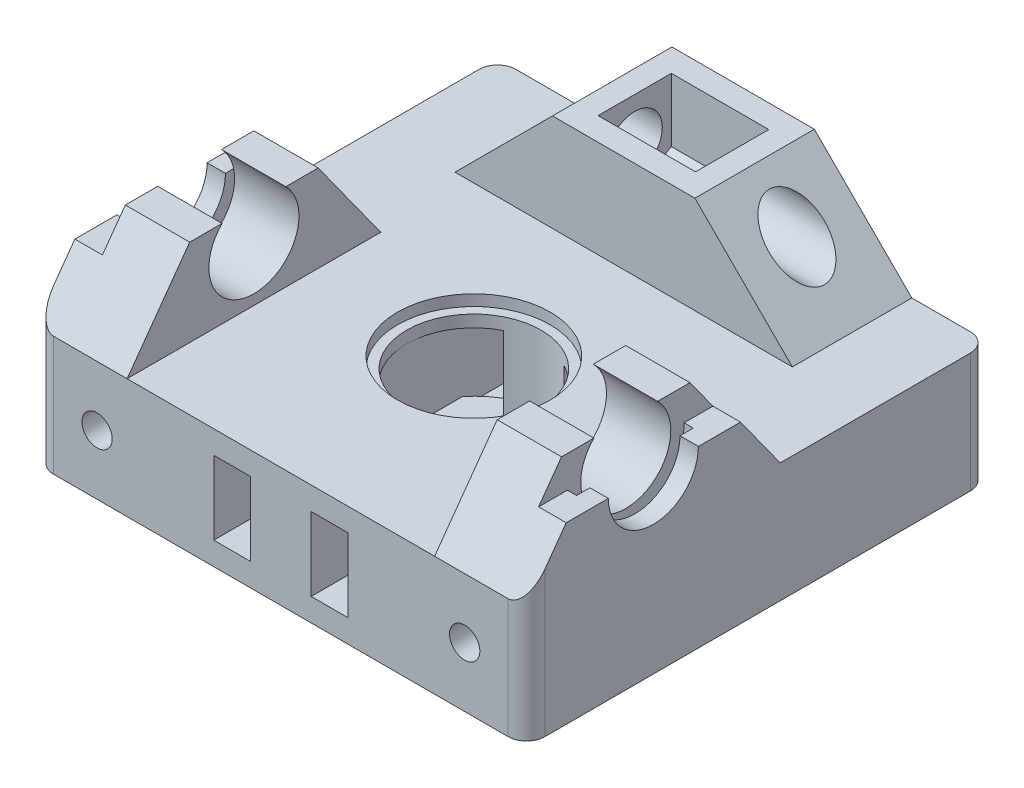
from build123d import *

# Parameters (mm, degrees)
SKETCH1_W           = 53.4573
SKETCH1_H           = 13
SKETCH1_R           = 4.2
BOSS_EXTRUDE1_DEPTH = 50.3
BOSS_EXTRUDE2_START = -15
SKETCH3_R           = 4.2
BOSS_EXTRUDE2_DEPTH = 15
SKETCH8_W           = 15.5
SKETCH8_H           = 13
BOSS_EXTRUDE3_DEPTH = 10.6
CHAMFER1_SIZE       = 10.6
SKETCH5_R           = 3
SKETCH5_R_2         = 4
CUT_EXTRUDE1_DEPTH  = 76.366988286
CUT_EXTRUDE2_DEPTH  = 5.3
BOSS_EXTRUDE4_DEPTH = 10
CUT_EXTRUDE3_DEPTH  = 1
SKETCH13_W          = 21.695080859
SKETCH13_H          = 9.09610943
CUT_EXTRUDE4_DEPTH  = 3
SKETCH16_R          = 1.65
CUT_EXTRUDE5_DEPTH  = 59.425257644
SKETCH17_R          = 7.3
CUT_EXTRUDE6_DEPTH  = 10.5
SKETCH15_W          = 4
SKETCH15_H          = 8
CUT_EXTRUDE7_DEPTH  = 60.472016368
SKETCH18_R          = 8.3
CUT_EXTRUDE8_DEPTH  = 1.2
SKETCH21_R          = 1.65
CUT_EXTRUDE9_DEPTH  = 60.472016368
CUT_EXTRUDE10_DEPTH = 2.6
FILLET1_R           = 2
CUT_EXTRUDE11_START = -1
CUT_EXTRUDE11_DEPTH = 10


# Read off the part's stored shape, not the designer's step: Cut-Extrude11
with BuildPart() as part:
    # Sketch1 → Boss-Extrude1 (new body)
    with BuildSketch(Plane.XY):
        Rectangle(SKETCH1_W, SKETCH1_H)
        with Locations(Location((-20, 0, 0), (0, 0, 180))):
            Circle(SKETCH1_R, mode=Mode.SUBTRACT)
        with Locations(Location((20, 0, 0), (0, 0, 180))):
            Circle(SKETCH1_R, mode=Mode.SUBTRACT)
    extrude(amount=BOSS_EXTRUDE1_DEPTH)

    # Sketch3 → Boss-Extrude2 (add)
    with BuildSketch(Plane.XY.offset(50.3).offset(BOSS_EXTRUDE2_START)):
        with Locations(Location((-20, 0, 0), (0, 0, 180))):
            Circle(SKETCH3_R)
        with Locations(Location((20, 0, 0), (0, 0, 180))):
            Circle(SKETCH3_R)
    extrude(amount=BOSS_EXTRUDE2_DEPTH)

    # Sketch8 → Boss-Extrude3 (add)
    with BuildSketch(Plane(origin=(0, 6.5, 0), x_dir=(1, 0, 0), z_dir=(0, 1, 0))):
        with Locations((0, -6.5)):
            Rectangle(SKETCH8_W, SKETCH8_H)
    extrude(amount=BOSS_EXTRUDE3_DEPTH)

    # Chamfer1
    chamfer1_edges = [part.edges().sort_by_distance(p)[0] for p in [
        (7.75, 6.5, 6.5),
        (-7.75, 6.5, 6.5),
    ]]
    chamfer(chamfer1_edges, length=CHAMFER1_SIZE - 0.0001)  # a hair under: the kernel refuses the full size

    # Sketch5 → Cut-Extrude1 (cut, through all)
    with BuildSketch(Plane.ZY.offset(26.72865)):
        with Locations(Location((6.5, 12.5, 0), (0, 0, 270))):
            Circle(SKETCH5_R)
        with Locations((36.5, 12.5)):
            Circle(SKETCH5_R_2)
    extrude(amount=-CUT_EXTRUDE1_DEPTH, mode=Mode.SUBTRACT)

    # Sketch10 → Cut-Extrude2 (cut)
    with BuildSketch(Plane.ZY):
        Polygon((2.516283143, 14.8), (2.516283143, 17.1), (10.483716857, 17.1), (10.483716857, 14.8), (10.483716857, 10.2), (6.5, 7.9), (2.516283143, 10.2), align=None)
    cut_extrude2 = extrude(amount=-CUT_EXTRUDE2_DEPTH, mode=Mode.SUBTRACT)

    # Mirror1: Cut-Extrude2 across plane
    add(cut_extrude2.mirror(Plane.ZY), mode=Mode.SUBTRACT)

    # Sketch11 → Boss-Extrude4 (add)
    with BuildSketch(Plane.ZY.offset(26.72865)):
        with BuildLine():
            Line((33.035176772, 15.964823228), (29.509293572, 15.964823228))
            Line((29.509293572, 15.964823228), (22.7, 6.5))
            Line((22.7, 6.5), (50.3, 6.5))
            Line((50.3, 6.5), (43.490706428, 15.964823228))
            Line((43.490706428, 15.964823228), (39.964823228, 15.964823228))
            ThreePointArc((39.964823228, 15.964823228), (36.5, 7.6), (33.035176772, 15.964823228))
        make_face()
    boss_extrude4 = extrude(amount=-BOSS_EXTRUDE4_DEPTH)

    # Sketch12 → Cut-Extrude3 (cut)
    with BuildSketch(Plane.ZY.offset(24.72865)):
        with BuildLine():
            Line((30.15, 12.5), (30.15, 21.960655534))
            Line((30.15, 21.960655534), (42.85, 21.960655534))
            Line((42.85, 21.960655534), (42.85, 12.5))
            ThreePointArc((42.85, 12.5), (36.5, 6.15), (30.15, 12.5))
        make_face()
    cut_extrude3 = extrude(amount=-CUT_EXTRUDE3_DEPTH, mode=Mode.SUBTRACT)

    # Sketch13 → Cut-Extrude4 (cut)
    with BuildSketch(Plane.ZY.offset(26.72865)):
        with Locations((35.453328021, 17.048054715)):
            Rectangle(SKETCH13_W, SKETCH13_H)
    cut_extrude4 = extrude(amount=-CUT_EXTRUDE4_DEPTH, mode=Mode.SUBTRACT)

    # Mirror2: Boss-Extrude4, Cut-Extrude3, Cut-Extrude4 across plane
    add(boss_extrude4.mirror(Plane.ZY))
    add(cut_extrude3.mirror(Plane.ZY), mode=Mode.SUBTRACT)
    add(cut_extrude4.mirror(Plane.ZY), mode=Mode.SUBTRACT)

    # Sketch16 → Cut-Extrude5 (cut, through all)
    with BuildSketch(Plane(origin=(0, 6.5, 0), x_dir=(1, 0, 0), z_dir=(0, 1, 0))):
        with Locations(Location((0, -29.3, 0), (0, 0, 180))):
            Circle(SKETCH16_R)
    extrude(amount=-CUT_EXTRUDE5_DEPTH, mode=Mode.SUBTRACT)

    # Sketch17 → Cut-Extrude6 (cut)
    with BuildSketch(Plane(origin=(0, 6.5, 0), x_dir=(1, 0, 0), z_dir=(0, 1, 0))):
        with Locations(Location((0, -29.3, 0), (0, 0, 180))):
            Circle(SKETCH17_R)
    extrude(amount=-CUT_EXTRUDE6_DEPTH, mode=Mode.SUBTRACT)

    # Sketch15 → Cut-Extrude7 (cut, through all)
    with BuildSketch(Plane(origin=(0, 0, 0), x_dir=(-1, 0, 0), z_dir=(0, 0, -1))):
        with Locations((-5.3, 0)):
            Rectangle(SKETCH15_W, SKETCH15_H)
    cut_extrude7 = extrude(amount=-CUT_EXTRUDE7_DEPTH, mode=Mode.SUBTRACT)

    # Mirror3: Cut-Extrude7 across plane
    add(cut_extrude7.mirror(Plane.ZY), mode=Mode.SUBTRACT)

    # Sketch18 → Cut-Extrude8 (cut)
    with BuildSketch(Plane(origin=(0, 6.5, 0), x_dir=(1, 0, 0), z_dir=(0, 1, 0))):
        with Locations(Location((0, -29.3, 0), (0, 0, 180))):
            Circle(SKETCH18_R)
    extrude(amount=-CUT_EXTRUDE8_DEPTH, mode=Mode.SUBTRACT)

    # Sketch20 → Revolve1 (revolve)
    with BuildSketch(Plane.ZY, mode=Mode.PRIVATE) as revolve1_sk:
        Polygon((30.95, -4), (30.95, -2), (31.95, -2), (33.95, -4), align=None)
    revolve(revolve1_sk.sketch.rotate(Axis((0, -4, 29.3), (0, 1, 0)), 270), axis=Axis((0, -4, 29.3), (0, 1, 0)))

    # Sketch21 → Cut-Extrude9 (cut, through all)
    with BuildSketch(Plane.XY.offset(50.3)):
        with Locations((20, 0)):
            Circle(SKETCH21_R)
        with Locations((-20, 0)):
            Circle(SKETCH21_R)
    extrude(amount=-CUT_EXTRUDE9_DEPTH, mode=Mode.SUBTRACT)

    # Sketch22 → Cut-Extrude10 (cut)
    with BuildSketch(Plane.XY.offset(46.3)):
        Polygon((-22.814582562, 1.414434516), (-22.814582562, 2.989434516), (-17.185417438, 2.989434516), (-17.185417438, 1.497865113), (-17.185417438, -1.625), (-17.185417438, -7.227237341), (-22.814582562, -7.227237341), (-22.814582562, -1.625), align=None)
    cut_extrude10 = extrude(amount=-CUT_EXTRUDE10_DEPTH, mode=Mode.SUBTRACT)

    # Mirror4: Cut-Extrude10 across plane
    add(cut_extrude10.mirror(Plane.ZY), mode=Mode.SUBTRACT)

    # Fillet1
    fillet1_edges = [part.edges().sort_by_distance(p)[0] for p in [
        (26.72865, 0, 0),
        (26.72865, 0, 50.3),
        (-26.72865, 0, 0),
        (-26.72865, 0, 50.3),
    ]]
    fillet(fillet1_edges, radius=FILLET1_R)

    # Cut-Extrude11 outline → Cut-Extrude11 (cut)
    with BuildSketch(Plane(origin=(0, -4, 0), x_dir=(1, 0, 0), z_dir=(0, 1, 0)).offset(CUT_EXTRUDE11_START)):
        with BuildLine():
            ThreePointArc((3.3, -20.391577019), (5.485502581, -21.543759839), (7.3, -23.220526339))
            Line((7.3, -23.220526339), (7.3, -2))
            Line((7.3, -2), (3.3, -2))
            Line((3.3, -2), (3.3, -20.391577019))
        make_face()
        with BuildLine():
            Line((-7.3, -2), (-7.3, -23.220526339))
            ThreePointArc((-7.3, -23.220526339), (-5.485502581, -21.543759839), (-3.3, -20.391577019))
            Line((-3.3, -20.391577019), (-3.3, -2))
            Line((-3.3, -2), (-7.3, -2))
        make_face()
    extrude(amount=CUT_EXTRUDE11_DEPTH, mode=Mode.SUBTRACT)


solid = part.part
